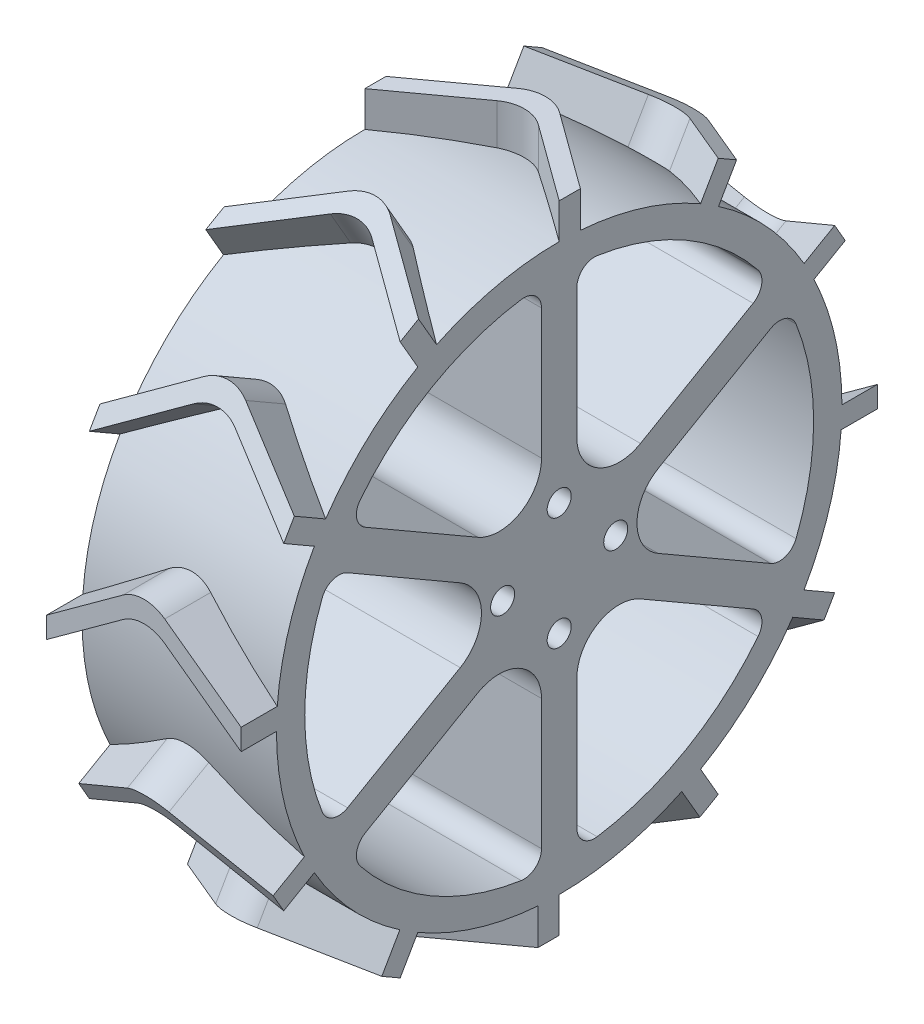
from build123d import *

# Parameters (mm, degrees)
SKETCH2_R                = 40
BOSS_EXTRUDE1_DEPTH      = 27.5
BOSS_EXTRUDE2_DEPTH      = 45
CIRPATTERN2_COUNT        = 12
CUT_EXTRUDE3_REACH       = 71.327
FILLET1_R                = 6
CIRPATTERN3_COUNT        = 6
FILLET1_OF_CIRPATTERN3_R = 6
CUT_EXTRUDE4_REACH       = 71.327
SKETCH6_R                = 1.7
SKETCH6_R_2              = 1.6999999999999995
SKETCH6_R_3              = 1.7000000000000008
SKETCH6_R_4              = 1.7000000000000004


with BuildPart() as part:
    # Sketch2 → Boss-Extrude1 (new body)
    with BuildSketch(Plane(origin=(0, 0, 0), x_dir=(0, 0, -1), z_dir=(1, 0, 0))):
        Circle(SKETCH2_R)
    extrude(amount=BOSS_EXTRUDE1_DEPTH)

    # Sketch4 → Boss-Extrude2 (add)
    with BuildSketch(Plane(origin=(0, 0, 0), x_dir=(1, 0, 0), z_dir=(0, 1, 0))):
        with BuildLine():
            Line((0, 0), (10.809141511624768, 7.861193826636196))
            ThreePointArc((10.809141511624768, 7.861193826636196), (13.75, 8.817513405120254), (16.69085848837523, 7.861193826636196))
            Line((16.69085848837523, 7.861193826636196), (27.5, 0))
            Line((27.5, 0), (27.5, 3))
            Line((27.5, 3), (16.69085848837523, 10.861193826636196))
            ThreePointArc((16.69085848837523, 10.861193826636196), (13.75, 11.817513405120252), (10.809141511624768, 10.861193826636196))
            Line((10.809141511624768, 10.861193826636196), (0, 3))
            Line((0, 3), (0, 0))
        make_face()
    boss_extrude2 = extrude(amount=BOSS_EXTRUDE2_DEPTH)

    # CirPattern2: Boss-Extrude2 ×12 about axis
    cirpattern2_axis = Axis((27.5, 0, 0), (-1, 0, 0))
    for i in range(1, CIRPATTERN2_COUNT):
        add(boss_extrude2.rotate(cirpattern2_axis, i * 360 / CIRPATTERN2_COUNT))

    # Sketch5 → Cut-Extrude3 (cut, up to next)
    with BuildSketch(Plane.ZY, mode=Mode.PRIVATE) as cut_extrude3_sk1:
        with BuildLine():
            Line((2.499999999999992, 33.12476415010377), (2.4999999999999987, 4.330127018922181))
            Line((2.4999999999999987, 4.330127018922181), (27.436887248357948, 18.727445584512928))
            ThreePointArc((27.436887248357948, 18.727445584512928), (28.6433531155643, 20.427992739848364), (28.141132565399595, 22.451651563673586))
            ThreePointArc((28.141132565399595, 22.451651563673586), (18.000000000000025, 31.176914536239778), (5.3731343283582, 35.59676147473838))
            ThreePointArc((5.3731343283582, 35.59676147473838), (3.3694841032506733, 35.019867817571004), (2.499999999999992, 33.12476415010377))
        make_face()
    cut_extrude3_tool1 = extrude(cut_extrude3_sk1.sketch, amount=-CUT_EXTRUDE3_REACH, mode=Mode.PRIVATE) & part.part
    cut_extrude3 = cut_extrude3_tool1.solids().sort_by_distance((0, 21.473973, 12.398004))[0]
    add(cut_extrude3, mode=Mode.SUBTRACT)

    # Fillet1
    fillet1_edges = [part.edges().sort_by_distance(p)[0] for p in [
        (13.75, 4.330127018922181, 2.4999999999999987),
    ]]
    fillet(fillet1_edges, radius=FILLET1_R)

    # CirPattern3: Cut-Extrude3 ×6 about axis
    cirpattern3_axis = Axis((0, 0, 0), (1, 0, 0))
    for i in range(1, CIRPATTERN3_COUNT):
        add(cut_extrude3.rotate(cirpattern3_axis, i * 360 / CIRPATTERN3_COUNT), mode=Mode.SUBTRACT)

    # Fillet1 of CirPattern3
    fillet1_of_cirpattern3_edges = [part.edges().sort_by_distance(p)[0] for p in [
        (13.75, -4.44e-15, 4.999999999999989),
        (13.75, -4.330127018922186, 2.499999999999991),
        (13.75, -4.330127018922181, -2.4999999999999982),
        (13.75, 2.22e-15, -4.999999999999989),
        (13.75, 4.3301270189221865, -2.49999999999999),
    ]]
    fillet(fillet1_of_cirpattern3_edges, radius=FILLET1_OF_CIRPATTERN3_R)

    # Sketch6 → Cut-Extrude4 (cut, up to next)
    with BuildSketch(Plane.ZY, mode=Mode.PRIVATE) as cut_extrude4_sk1:
        with Locations((0, 8)):
            Circle(SKETCH6_R)
    cut_extrude4_tool1 = extrude(cut_extrude4_sk1.sketch, amount=-CUT_EXTRUDE4_REACH, mode=Mode.PRIVATE) & part.part
    # Sketch6 → Cut-Extrude4 (cut, up to next)
    with BuildSketch(Plane.ZY, mode=Mode.PRIVATE) as cut_extrude4_sk2:
        with Locations((8, 4.3e-16)):
            Circle(SKETCH6_R_2)
    cut_extrude4_tool2 = extrude(cut_extrude4_sk2.sketch, amount=-CUT_EXTRUDE4_REACH, mode=Mode.PRIVATE) & part.part
    # Sketch6 → Cut-Extrude4 (cut, up to next)
    with BuildSketch(Plane.ZY, mode=Mode.PRIVATE) as cut_extrude4_sk3:
        with Locations((9.8e-16, -8)):
            Circle(SKETCH6_R_3)
    cut_extrude4_tool3 = extrude(cut_extrude4_sk3.sketch, amount=-CUT_EXTRUDE4_REACH, mode=Mode.PRIVATE) & part.part
    # Sketch6 → Cut-Extrude4 (cut, up to next)
    with BuildSketch(Plane.ZY, mode=Mode.PRIVATE) as cut_extrude4_sk4:
        with Locations((-8, 6.5e-16)):
            Circle(SKETCH6_R_4)
    cut_extrude4_tool4 = extrude(cut_extrude4_sk4.sketch, amount=-CUT_EXTRUDE4_REACH, mode=Mode.PRIVATE) & part.part
    add(cut_extrude4_tool1.solids().sort_by_distance((0, 8, 0))[0], mode=Mode.SUBTRACT)
    add(cut_extrude4_tool2.solids().sort_by_distance((0, 0, 8))[0], mode=Mode.SUBTRACT)
    add(cut_extrude4_tool3.solids().sort_by_distance((0, -8, 0))[0], mode=Mode.SUBTRACT)
    add(cut_extrude4_tool4.solids().sort_by_distance((0, 0, -8))[0], mode=Mode.SUBTRACT)


solid = part.part
